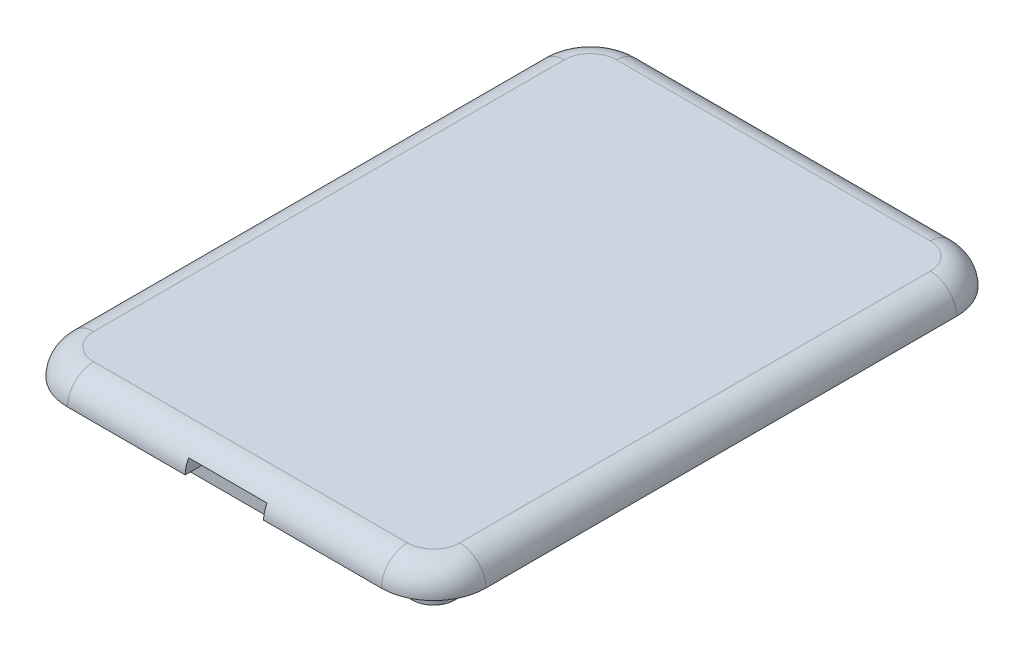
from build123d import *

# Parameters (mm, degrees)
SKETCH1_W           = 71.12
SKETCH1_H           = 109.22
BOSS_EXTRUDE1_DEPTH = 6.35
BOSS_EXTRUDE3_DEPTH = 6.35
FILLET1_R           = 6.35
SKETCH3_W           = 19.05
SKETCH3_H           = 6.35
CUT_EXTRUDE1_DEPTH  = 6.35


with BuildPart() as part:
    # Sketch1 → Boss-Extrude1 (new body)
    with BuildSketch(Plane(origin=(0, 0, 0), x_dir=(1, 0, 0), z_dir=(0, 1, 0))):
        with BuildLine():
            Line((-40.159459459, 57.460725462), (36.040540541, 57.460725462))
            ThreePointArc((36.040540541, 57.460725462), (39.632642989, 55.972827911), (41.120540541, 52.380725462))
            Line((41.120540541, 52.380725462), (41.120540541, -61.919274538))
            ThreePointArc((41.120540541, -61.919274538), (39.632642989, -65.511376986), (36.040540541, -66.999274538))
            Line((36.040540541, -66.999274538), (-40.159459459, -66.999274538))
            ThreePointArc((-40.159459459, -66.999274538), (-43.751561908, -65.511376986), (-45.239459459, -61.919274538))
            Line((-45.239459459, -61.919274538), (-45.239459459, 52.380725462))
            ThreePointArc((-45.239459459, 52.380725462), (-43.751561908, 55.972827911), (-40.159459459, 57.460725462))
        make_face()
        with Locations((-2.059459459, -4.769274538)):
            Rectangle(SKETCH1_W, SKETCH1_H, mode=Mode.SUBTRACT)
    extrude(amount=-BOSS_EXTRUDE1_DEPTH)

    # Sketch1<4> → Boss-Extrude3 (add)
    with BuildSketch(Plane(origin=(0, 0, 0), x_dir=(1, 0, 0), z_dir=(0, 1, 0))):
        with BuildLine():
            Line((-40.159459459, 65.080725462), (36.040540541, 65.080725462))
            ThreePointArc((36.040540541, 65.080725462), (45.020796662, 61.360981583), (48.740540541, 52.380725462))
            Line((48.740540541, 52.380725462), (48.740540541, -61.919274538))
            ThreePointArc((48.740540541, -61.919274538), (45.020796662, -70.899530659), (36.040540541, -74.619274538))
            Line((36.040540541, -74.619274538), (-40.159459459, -74.619274538))
            ThreePointArc((-40.159459459, -74.619274538), (-49.139715581, -70.899530659), (-52.859459459, -61.919274538))
            Line((-52.859459459, -61.919274538), (-52.859459459, 52.380725462))
            ThreePointArc((-52.859459459, 52.380725462), (-49.139715581, 61.360981583), (-40.159459459, 65.080725462))
        make_face()
    extrude(amount=BOSS_EXTRUDE3_DEPTH)

    # Fillet1
    fillet1_edges = [part.edges().sort_by_distance(p)[0] for p in [
        (-49.139715581, 6.35, -61.360981583),
        (-2.059459459, 6.35, -65.080725462),
        (45.020796662, 6.35, -61.360981583),
        (48.740540541, 6.35, 4.769274538),
        (45.020796662, 6.35, 70.899530659),
        (-2.059459459, 6.35, 74.619274538),
        (-49.139715581, 6.35, 70.899530659),
        (-52.859459459, 6.35, 4.769274538),
    ]]
    fillet(fillet1_edges, radius=FILLET1_R - 0.0001)  # a hair under: the kernel refuses the full size

    # Sketch3 → Cut-Extrude1 (cut)
    with BuildSketch(Plane.XY.offset(74.619274538)):
        with Locations((-2.059459459, 0)):
            Rectangle(SKETCH3_W, SKETCH3_H)
    extrude(amount=-CUT_EXTRUDE1_DEPTH, mode=Mode.SUBTRACT)


solid = part.part
